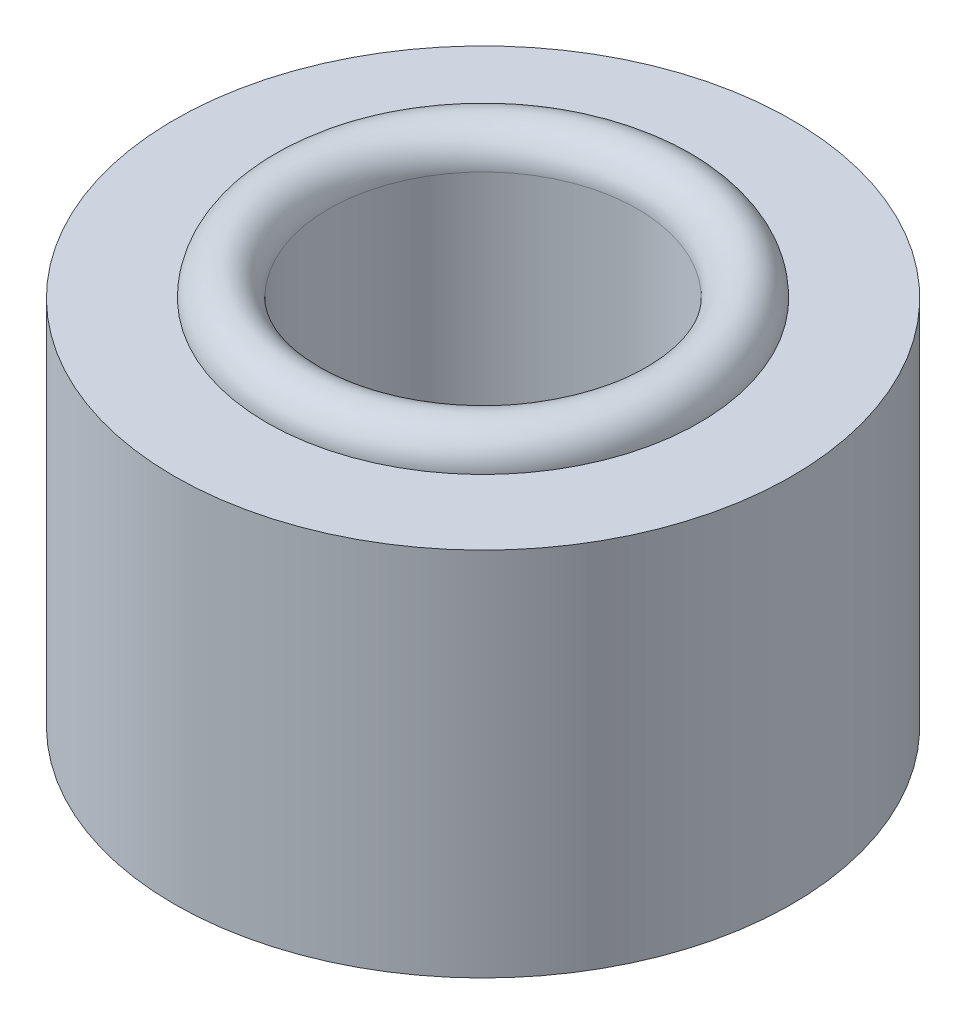
from build123d import *

# Parameters (mm, degrees)
PROFILE_SKETCH_R              = 10
PROFILE_SKETCH_R_2            = 5
CYLINDER_EXTRUDE_DEPTH        = 12
LIP_RING_SKETCH_R             = 7
LIP_RING_SKETCH_R_2           = 5
BOTTOM_LIP_RING_EXTRUDE_DEPTH = 1
BOTTOM_RING_FILLET_R          = 1
TOP_START                     = -13
SKETCH2_2_R                   = 7
SKETCH2_2_R_2                 = 5
TOP_LIP_RING_EXTRUDE_DEPTH    = 1
TOP_RING_FILLET_R             = 1


with BuildPart() as part:
    # Profile Sketch → Cylinder Extrude (new body)
    with BuildSketch(Plane(origin=(0, 0, 0), x_dir=(1, 0, 0), z_dir=(0, 1, 0))):
        with Locations(Location((0, 0, 0), (0, 0, 270))):
            Circle(PROFILE_SKETCH_R)
        with Locations(Location((0, 0, 0), (0, 0, 270))):
            Circle(PROFILE_SKETCH_R_2, mode=Mode.SUBTRACT)
    extrude(amount=CYLINDER_EXTRUDE_DEPTH)

    # Lip Ring Sketch → Bottom Lip Ring Extrude (add)
    with BuildSketch(Plane(origin=(0, 12, 0), x_dir=(1, 0, 0), z_dir=(0, 1, 0))):
        with Locations(Location((0, 0, 0), (0, 0, 270))):
            Circle(LIP_RING_SKETCH_R)
        with Locations(Location((0, 0, 0), (0, 0, 270))):
            Circle(LIP_RING_SKETCH_R_2, mode=Mode.SUBTRACT)
    extrude(amount=BOTTOM_LIP_RING_EXTRUDE_DEPTH)

    # Bottom Ring Fillet
    bottom_ring_fillet_edges = [part.edges().sort_by_distance(p)[0] for p in [
        (0, 13, -7),
        (0, 13, -5),
    ]]
    fillet(bottom_ring_fillet_edges, radius=BOTTOM_RING_FILLET_R - 0.0001)  # a hair under: the kernel refuses the full size

    # Sketch2<2> → Top Lip Ring Extrude (add)
    with BuildSketch(Plane(origin=(0, 12, 0), x_dir=(1, 0, 0), z_dir=(0, 1, 0)).offset(TOP_START)):
        with Locations(Location((0, 0, 0), (0, 0, 270))):
            Circle(SKETCH2_2_R)
        with Locations(Location((0, 0, 0), (0, 0, 270))):
            Circle(SKETCH2_2_R_2, mode=Mode.SUBTRACT)
    extrude(amount=TOP_LIP_RING_EXTRUDE_DEPTH)

    # Top Ring Fillet
    top_ring_fillet_edges = [part.edges().sort_by_distance(p)[0] for p in [
        (0, -1, -7),
        (0, -1, -5),
    ]]
    fillet(top_ring_fillet_edges, radius=TOP_RING_FILLET_R - 0.0001)  # a hair under: the kernel refuses the full size


solid = part.part
